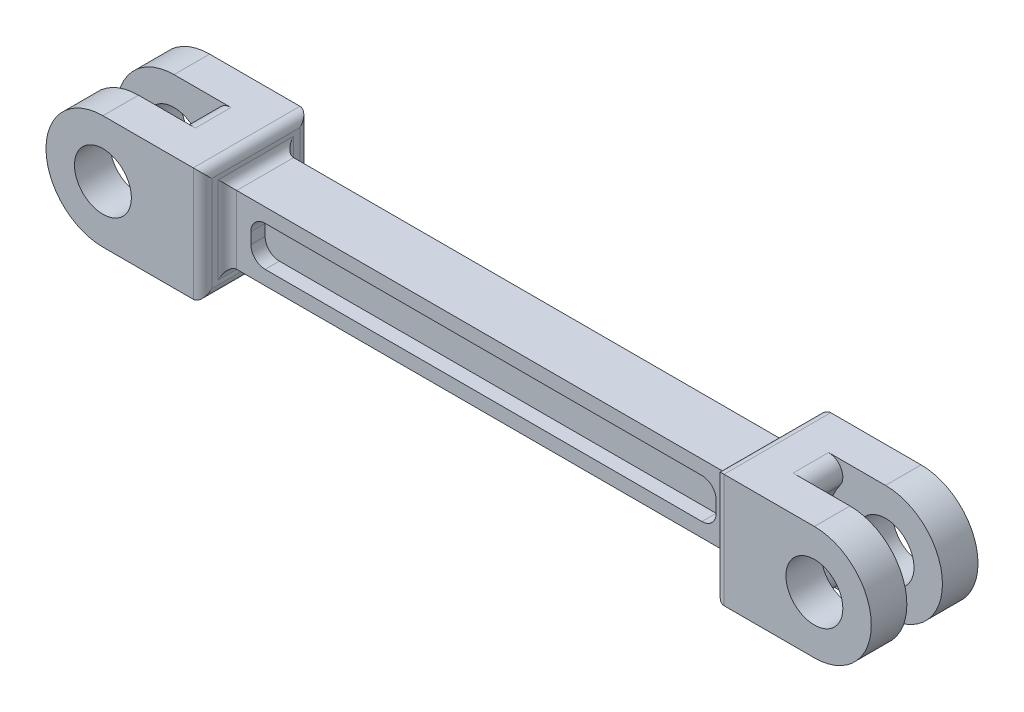
from build123d import *

# Parameters (mm, degrees)
SKETCH1_W            = 180
SKETCH1_H            = 24
BOSS_EXTRUDE3_DEPTH  = 10
SKETCH1_6_R          = 20
SKETCH1_6_R_2        = 10
HEAD_WIDTH_DEPTH     = 18.75
SKETCH1_7_R          = 20
SKETCH1_7_R_2        = 10
CUT_EXTRUDE1_DEPTH   = 6.25
FILLET1_START        = -6.25
FILLET1_DEPTH        = 12.5
FILLET2_R            = 3.25
SKETCH2_W            = 163.5
SKETCH2_H            = 14
CUT_EXTRUDE2_DEPTH   = 5
FILLET3_R            = 5
FILLET3_OF_MIRROR1_R = 5


with BuildPart() as part:
    # Sketch1 → Boss-Extrude3 (new, symmetric)
    with BuildSketch(Plane.XY):
        with Locations((125, 0)):
            Rectangle(SKETCH1_W, SKETCH1_H)
    extrude(amount=BOSS_EXTRUDE3_DEPTH, both=True)

    # Sketch1<6> → Head Width (add, symmetric)
    # profile 1 of 4: a face of its own
    with BuildSketch(Plane.XY):
        with BuildLine():
            Line((35, -12), (35, 12))
            Line((35, 12), (35, 20))
            Line((35, 20), (0, 20))
            ThreePointArc((0, 20), (14.142135624, 14.142135624), (20, 0))
            ThreePointArc((20, 0), (14.142135624, -14.142135624), (0, -20))
            Line((0, -20), (35, -20))
            Line((35, -20), (35, -12))
        make_face()
    # profile 2 of 4: a face of its own
    with BuildSketch(Plane.XY):
        Circle(SKETCH1_6_R)
        Circle(SKETCH1_6_R_2, mode=Mode.SUBTRACT)
    # profile 3 of 4: a face of its own
    with BuildSketch(Plane.XY):
        with BuildLine():
            Line((215, 20), (215, 12))
            Line((215, 12), (215, -12))
            Line((215, -12), (215, -20))
            Line((215, -20), (250, -20))
            ThreePointArc((250, -20), (230, 0), (250, 20))
            Line((250, 20), (215, 20))
        make_face()
    # profile 4 of 4: a face of its own
    with BuildSketch(Plane.XY):
        with Locations((250, 0)):
            Circle(SKETCH1_6_R)
        with Locations((250, 0)):
            Circle(SKETCH1_6_R_2, mode=Mode.SUBTRACT)
    extrude(amount=HEAD_WIDTH_DEPTH, both=True)

    # Sketch1<7> → Cut-Extrude1 (cut, symmetric)
    # profile 1 of 2: a face of its own
    with BuildSketch(Plane.XY):
        Circle(SKETCH1_7_R)
        Circle(SKETCH1_7_R_2, mode=Mode.SUBTRACT)
    # profile 2 of 2: a face of its own
    with BuildSketch(Plane.XY):
        with Locations((250, 0)):
            Circle(SKETCH1_7_R)
        with Locations((250, 0)):
            Circle(SKETCH1_7_R_2, mode=Mode.SUBTRACT)
    extrude(amount=CUT_EXTRUDE1_DEPTH, both=True, mode=Mode.SUBTRACT)

    # Fillet1: read off the stored shape, not the designer's step
    # Fillet1 outline → Fillet1 (cut)
    with BuildSketch(Plane.XY.offset(FILLET1_START)):
        with BuildLine():
            ThreePointArc((230, 20), (234.472135955, 17.236067977), (234, 12))
            ThreePointArc((234, 12), (241.05572809, 17.88854382), (250, 20))
            Line((250, 20), (230, 20))
        make_face()
        with BuildLine():
            ThreePointArc((234, -12), (234.472135955, -17.236067977), (230, -20))
            Line((230, -20), (250, -20))
            ThreePointArc((250, -20), (241.05572809, -17.88854382), (234, -12))
        make_face()
        with BuildLine():
            ThreePointArc((20, -20), (15.527864045, -17.236067977), (16, -12))
            ThreePointArc((16, -12), (8.94427191, -17.88854382), (0, -20))
            Line((0, -20), (20, -20))
        make_face()
        with BuildLine():
            ThreePointArc((0, 20), (8.94427191, 17.88854382), (16, 12))
            ThreePointArc((16, 12), (15.527864045, 17.236067977), (20, 20))
            Line((20, 20), (0, 20))
        make_face()
    extrude(amount=FILLET1_DEPTH, mode=Mode.SUBTRACT)

    # Fillet2
    fillet2_edges = [part.edges().sort_by_distance(p)[0] for p in [
        (35, 0, 10),
        (35, 20, 0),
        (35, 0, 18.75),
        (35, -20, 0),
        (35, 0, -18.75),
        (215, -20, 0),
        (215, 0, -18.75),
        (215, 20, 0),
        (215, 0, 18.75),
        (215, 0, 10),
        (35, 0, -10),
        (215, 0, -10),
        (215, -12, 0),
        (35, -12, 0),
        (35, 12, 0),
        (215, 12, 0),
    ]]
    fillet(fillet2_edges, radius=FILLET2_R)

    # Sketch2 → Cut-Extrude2 (cut)
    with BuildSketch(Plane.XY.offset(10)):
        with Locations((125, 0)):
            Rectangle(SKETCH2_W, SKETCH2_H)
    cut_extrude2 = extrude(amount=-CUT_EXTRUDE2_DEPTH, mode=Mode.SUBTRACT)

    # Fillet3
    fillet3_edges = [part.edges().sort_by_distance(p)[0] for p in [
        (43.25, -7, 7.5),
        (43.25, 7, 7.5),
        (206.75, 7, 7.5),
        (206.75, -7, 7.5),
    ]]
    fillet(fillet3_edges, radius=FILLET3_R)

    # Mirror1: Cut-Extrude2 across plane
    add(cut_extrude2.mirror(Plane.XY), mode=Mode.SUBTRACT)

    # Fillet3 of Mirror1
    fillet3_of_mirror1_edges = [part.edges().sort_by_distance(p)[0] for p in [
        (43.25, -7, -7.5),
        (43.25, 7, -7.5),
        (206.75, 7, -7.5),
        (206.75, -7, -7.5),
    ]]
    fillet(fillet3_of_mirror1_edges, radius=FILLET3_OF_MIRROR1_R)


solid = part.part
